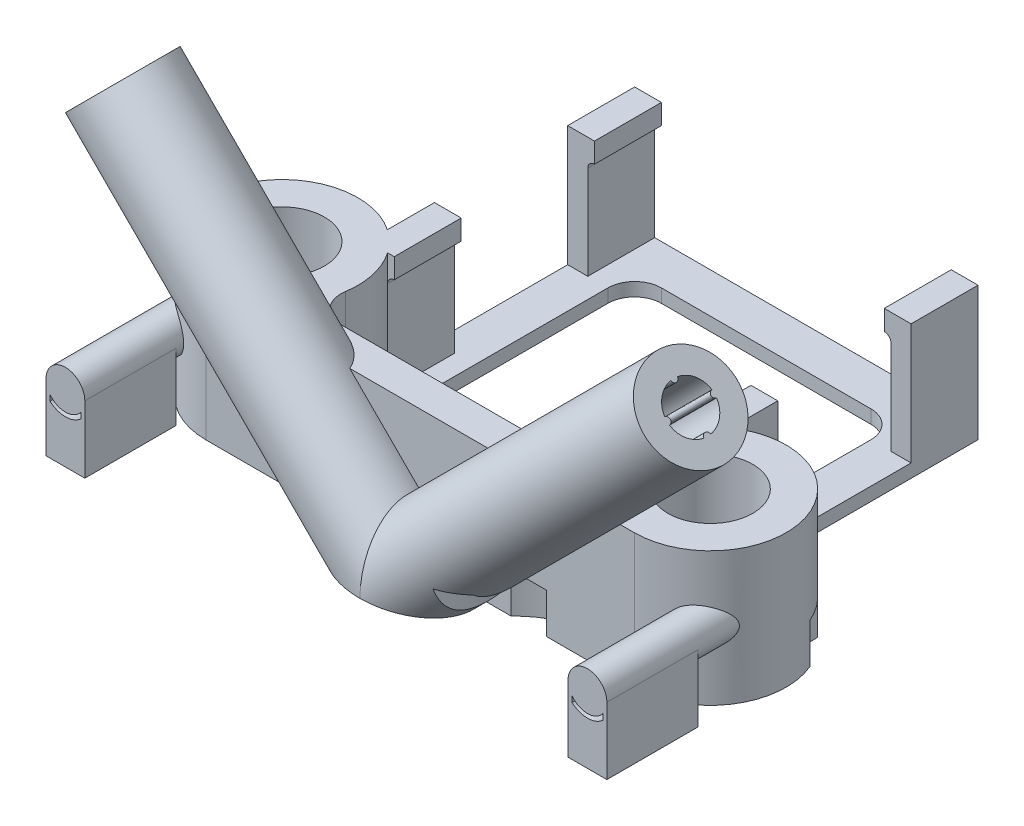
from build123d import *

# Parameters (mm, degrees)
SKETCH1_R               = 3.175
BOSS_EXTRUDE1_DEPTH     = 10
BOSS_EXTRUDE2_REACH     = 28.432
SKETCH2_R               = 1.45
BOSS_EXTRUDE3_START     = 2.5
SKETCH3_R               = 1.45
BOSS_EXTRUDE3_DEPTH     = 2.5
BOSS_EXTRUDE4_REACH     = 50.541
SKETCH6_R               = 3.5
CUT_EXTRUDE2_REACH      = 50.918
SKETCH7_R               = 1.775
CUT_EXTRUDE3_REACH      = 36.649
CUT_EXTRUDE3_END_RADIUS = 1.775
SKETCH8_R               = 1.75
BOSS_EXTRUDE5_START     = 4.5
SKETCH9_R               = 1.45
BOSS_EXTRUDE5_DEPTH     = 4.5
CUT_EXTRUDE4_REACH      = 53.252
SKETCH10_R              = 1.775
CUT_EXTRUDE5_START      = -3
CUT_EXTRUDE5_DEPTH      = 3
SKETCH12_R              = 0.25
BOSS_EXTRUDE6_DEPTH     = 20
BOSS_EXTRUDE7_REACH     = 37.818
SKETCH13_W              = 2.9
SKETCH13_H              = 6.810535762
CUT_EXTRUDE6_DEPTH      = 6.810535762
SKETCH15_W              = 25.65
SKETCH15_H              = 26.35
SKETCH15_W_2            = 19.65
SKETCH15_H_2            = 20.35
BOSS_EXTRUDE8_DEPTH     = 1
SKETCH16_W              = 1.5
SKETCH16_H              = 5
BOSS_EXTRUDE9_DEPTH     = 7.5
SKETCH17_W              = 2
SKETCH17_H              = 5
BOSS_EXTRUDE10_DEPTH    = 1.5
FILLET1_R               = 0.5
FILLET2_R               = 2


# Read off the part's stored shape, not the designer's step: Cut-Extrude5
# Some blends are built 0.0001 mm under size
with BuildPart() as part:
    # Sketch1 → Boss-Extrude1 (new body)
    with BuildSketch(Plane(origin=(0, 0, 0), x_dir=(1, 0, 0), z_dir=(0, 1, 0))):
        with BuildLine():
            Line((11.296278069, -3.175), (-11.296278069, -3.175))
            ThreePointArc((-11.296278069, -3.175), (-18.663409469, 5.011175012), (-16, -5.675))
            Line((-16, -5.675), (16, -5.675))
            ThreePointArc((16, -5.675), (18.663409469, 5.011175012), (11.296278069, -3.175))
        make_face()
        with Locations(Location((-16, 0, 0), (0, 0, 270))):
            Circle(SKETCH1_R, mode=Mode.SUBTRACT)
        with Locations(Location((16, 0, 0), (0, 0, 270))):
            Circle(SKETCH1_R, mode=Mode.SUBTRACT)
    extrude(amount=BOSS_EXTRUDE1_DEPTH)

    # Sketch2 → Boss-Extrude2 (add, up to next)
    with BuildSketch(Plane.XY.offset(5.675), mode=Mode.PRIVATE) as boss_extrude2_sk1:
        with Locations((-19.5, 5)):
            Circle(SKETCH2_R)
    boss_extrude2_tool1 = extrude(boss_extrude2_sk1.sketch, amount=-BOSS_EXTRUDE2_REACH, mode=Mode.PRIVATE) - part.part
    # Sketch2 → Boss-Extrude2 (add, up to next)
    with BuildSketch(Plane.XY.offset(5.675), mode=Mode.PRIVATE) as boss_extrude2_sk2:
        with Locations((19.5, 5)):
            Circle(SKETCH2_R)
    boss_extrude2_tool2 = extrude(boss_extrude2_sk2.sketch, amount=-BOSS_EXTRUDE2_REACH, mode=Mode.PRIVATE) - part.part
    add(boss_extrude2_tool1.solids().sort_by_distance((-19.5, 5, 5.675))[0])
    add(boss_extrude2_tool2.solids().sort_by_distance((19.5, 5, 5.675))[0])

    # Sketch3 → Boss-Extrude3 (add)
    with BuildSketch(Plane.XY.offset(5.675).offset(BOSS_EXTRUDE3_START)):
        with Locations((-19.5, 5)):
            Circle(SKETCH3_R)
        with Locations((19.5, 5)):
            Circle(SKETCH3_R)
    extrude(amount=-BOSS_EXTRUDE3_DEPTH)

    # Boss-Extrude4: up to this plane
    boss_extrude4_end = Plane(origin=(0, 0, 0), z_dir=(0, 1, 0))
    # Sketch6 → Boss-Extrude4 (add, up to the surface)
    with BuildSketch(Plane(origin=(-21.213203436, 21.213203436, 0), x_dir=(0.7071067811865477, 0.7071067811865475, 0), z_dir=(-0.7071067811865475, 0.7071067811865477, 0)), mode=Mode.PRIVATE) as boss_extrude4_sk1:
        with Locations(Location((0, -6.675, 0), (0, 0, 180))):
            Circle(SKETCH6_R)
    boss_extrude4_tool1 = split(extrude(boss_extrude4_sk1.sketch, amount=-BOSS_EXTRUDE4_REACH, mode=Mode.PRIVATE), bisect_by=boss_extrude4_end, keep=Keep.BOTH, mode=Mode.PRIVATE)
    boss_extrude4 = boss_extrude4_tool1.solids().sort_by_distance((-21.213203, 21.213203, 6.675))[0]
    add(boss_extrude4)

    # Cut-Extrude2: up to this plane
    cut_extrude2_end = Plane(origin=(0, 0, 0), z_dir=(0, 1, 0))
    # Sketch7 → Cut-Extrude2 (cut, up to the surface)
    with BuildSketch(Plane(origin=(-21.213203436, 21.213203436, 0), x_dir=(0, 0, 1), z_dir=(-0.7071067811865476, 0.7071067811865476, 0)), mode=Mode.PRIVATE) as cut_extrude2_sk1:
        with Locations(Location((6.675, 0, 0), (0, 0, 270))):
            Circle(SKETCH7_R)
    cut_extrude2_tool1 = split(extrude(cut_extrude2_sk1.sketch, amount=-CUT_EXTRUDE2_REACH, mode=Mode.PRIVATE), bisect_by=cut_extrude2_end, keep=Keep.BOTH, mode=Mode.PRIVATE)
    cut_extrude2 = cut_extrude2_tool1.solids().sort_by_distance((-21.213203, 21.213203, 6.675))[0]
    add(cut_extrude2, mode=Mode.SUBTRACT)

    # Cut-Extrude3: up to this cylinder (the profile starts outside it)
    cut_extrude3_end = Plane(origin=(-5, 5, 6.675), z_dir=(-0.7071067811865476, 0.7071067811865476, 0)) * Cylinder(CUT_EXTRUDE3_END_RADIUS, 77.848, mode=Mode.PRIVATE)
    # Sketch8 → Cut-Extrude3 (cut, up to the surface)
    with BuildSketch(Plane(origin=(0, 0, 3.175), x_dir=(-1, 0, 0), z_dir=(0, 0, -1)), mode=Mode.PRIVATE) as cut_extrude3_sk1:
        with Locations((5, 5)):
            Circle(SKETCH8_R)
    cut_extrude3_tool1 = extrude(cut_extrude3_sk1.sketch, amount=-CUT_EXTRUDE3_REACH, mode=Mode.PRIVATE) - cut_extrude3_end
    cut_extrude3 = cut_extrude3_tool1.solids().sort_by_distance((-5, 5, 3.175))[0]
    add(cut_extrude3, mode=Mode.SUBTRACT)

    # Mirror1: Boss-Extrude4, Cut-Extrude2, Cut-Extrude3 across plane
    add(boss_extrude4.mirror(Plane(origin=(0, 0, 0), x_dir=(0, 0, 1), z_dir=(1, 0, 0))))
    add(cut_extrude2.mirror(Plane(origin=(0, 0, 0), x_dir=(0, 0, 1), z_dir=(1, 0, 0))), mode=Mode.SUBTRACT)
    add(cut_extrude3.mirror(Plane(origin=(0, 0, 0), x_dir=(0, 0, 1), z_dir=(1, 0, 0))), mode=Mode.SUBTRACT)

    # Sketch9 → Boss-Extrude5 (add)
    with BuildSketch(Plane.XY.offset(8.175).offset(BOSS_EXTRUDE5_START)):
        with Locations((-19.5, 5)):
            Circle(SKETCH9_R)
        with Locations((19.5, 5)):
            Circle(SKETCH9_R)
    extrude(amount=-BOSS_EXTRUDE5_DEPTH)

    # Cut-Extrude4: up to this face of the body (flat: up to its plane)
    cut_extrude4_end = Plane(part.part.faces().sort_by_distance((10.371708245, 0, 5.213432562))[0])
    # Sketch10 → Cut-Extrude4 (cut, up to the picked face)
    with BuildSketch(Plane(origin=(-21.213203436, 21.213203436, 0), x_dir=(0, 0, 1), z_dir=(-0.7071067811865476, 0.7071067811865476, 0)), mode=Mode.PRIVATE) as cut_extrude4_sk1:
        with Locations(Location((6.675, 0, 0), (0, 0, 270))):
            Circle(SKETCH10_R)
    cut_extrude4_tool1 = split(extrude(cut_extrude4_sk1.sketch, amount=-CUT_EXTRUDE4_REACH, mode=Mode.PRIVATE), bisect_by=cut_extrude4_end, keep=Keep.BOTH, mode=Mode.PRIVATE)
    add(cut_extrude4_tool1.solids().sort_by(Axis((-21.213203, 21.213203, 6.675), (0.7071067811865476, -0.7071067811865476, 0)))[0], mode=Mode.SUBTRACT)

    # Cut-Extrude5 outline → Cut-Extrude5 (cut)
    with BuildSketch(Plane.XZ.offset(CUT_EXTRUDE5_START)):
        with BuildLine():
            Line((10.519576691, 3.625), (16, 3.625))
            ThreePointArc((16, 3.625), (18.563262082, 2.563262082), (19.625, 0))
            Line((19.625, 0), (19.625, -4.366348589))
            ThreePointArc((19.625, -4.366348589), (20.553899173, -3.386388537), (21.225, -2.214723459))
            Line((21.225, -2.214723459), (21.225, 0))
            ThreePointArc((21.225, 0), (19.694632932, 3.694632932), (16, 5.225))
            Line((16, 5.225), (10.519576691, 5.225))
            add(Edge.make_bspline(
                [(10.519576691, 5.225), (6.782537152, 6.461403164), (6.878008537, 10.175)],
                knots=[0.842781907, 0.842781907, 0.842781907, 1.842781907, 1.842781907, 1.842781907], degree=2))
            Line((6.878008537, 10.175), (5.102744062, 10.175))
            add(Edge.make_bspline(
                [(5.102744062, 10.175), (5.38264147, 4.912584992), (10.519576691, 3.625)],
                knots=[0, 0, 0, 1, 1, 1], degree=2))
        make_face()
    extrude(amount=CUT_EXTRUDE5_DEPTH, mode=Mode.SUBTRACT)

    # Sketch12 → Boss-Extrude6 (add)
    with BuildSketch(Plane(origin=(-21.213203436, 21.213203436, 0), x_dir=(0, 0, 1), z_dir=(-0.7071067811865476, 0.7071067811865476, 0))):
        with Locations((6.675, 1.775)):
            Circle(SKETCH12_R)
        with Locations((4.9, 0)):
            Circle(SKETCH12_R)
        with Locations((6.675, -1.775)):
            Circle(SKETCH12_R)
        with Locations((8.45, 0)):
            Circle(SKETCH12_R)
    boss_extrude6 = extrude(amount=-BOSS_EXTRUDE6_DEPTH)

    # Mirror2: Boss-Extrude6 across plane
    add(boss_extrude6.mirror(Plane(origin=(0, 0, 0), x_dir=(0, 0, 1), z_dir=(1, 0, 0))))

    # Sketch13 → Boss-Extrude7 (add, up to next)
    with BuildSketch(Plane.XZ, mode=Mode.PRIVATE) as boss_extrude7_sk1:
        with Locations((-19.5, 9.269732119)):
            Rectangle(SKETCH13_W, SKETCH13_H)
    boss_extrude7_tool1 = extrude(boss_extrude7_sk1.sketch, amount=-BOSS_EXTRUDE7_REACH, mode=Mode.PRIVATE) - part.part
    # Sketch13 → Boss-Extrude7 (add, up to next)
    with BuildSketch(Plane.XZ, mode=Mode.PRIVATE) as boss_extrude7_sk2:
        with Locations((19.5, 9.269732119)):
            Rectangle(SKETCH13_W, SKETCH13_H)
    boss_extrude7_tool2 = extrude(boss_extrude7_sk2.sketch, amount=-BOSS_EXTRUDE7_REACH, mode=Mode.PRIVATE) - part.part
    add(boss_extrude7_tool1.solids().sort_by_distance((-19.5, 0, 9.269732))[0])
    add(boss_extrude7_tool2.solids().sort_by_distance((19.5, 0, 9.269732))[0])

    # Sketch14 → Cut-Extrude6 (cut)
    with BuildSketch(Plane.XY.offset(12.675)):
        with BuildLine():
            Line((-20.65, 4.116823913), (-20.65, 3.680909404))
            ThreePointArc((-20.65, 3.680909404), (-19.5, 3.25), (-18.35, 3.680909404))
            Line((-18.35, 3.680909404), (-18.35, 4.116823913))
            ThreePointArc((-18.35, 4.116823913), (-19.5, 3.55), (-20.65, 4.116823913))
        make_face()
        with BuildLine():
            ThreePointArc((18.35, 3.680909404), (19.5, 3.25), (20.65, 3.680909404))
            Line((20.65, 3.680909404), (20.65, 4.116823913))
            ThreePointArc((20.65, 4.116823913), (19.5, 3.55), (18.35, 4.116823913))
            Line((18.35, 4.116823913), (18.35, 3.680909404))
        make_face()
    extrude(amount=-CUT_EXTRUDE6_DEPTH, mode=Mode.SUBTRACT)

    # Sketch15 → Boss-Extrude8 (add)
    with BuildSketch(Plane(origin=(0, 0, 0), x_dir=(1, 0, 0), z_dir=(0, 1, 0))):
        with Locations((0, 10)):
            Rectangle(SKETCH15_W, SKETCH15_H)
        with Locations((0, 10)):
            Rectangle(SKETCH15_W_2, SKETCH15_H_2, mode=Mode.SUBTRACT)
    extrude(amount=BOSS_EXTRUDE8_DEPTH)

    # Sketch16 → Boss-Extrude9 (add)
    with BuildSketch(Plane(origin=(0, 1, 0), x_dir=(1, 0, 0), z_dir=(0, 1, 0))):
        with Locations((-12.075, 20.675)):
            Rectangle(SKETCH16_W, SKETCH16_H)
        with BuildLine():
            Line((-11.325, 8.217141588), (-12.825, 8.217141588))
            Line((-12.825, 8.217141588), (-12.825, 4.703721931))
            ThreePointArc((-12.825, 4.703721931), (-12.005240273, 4.030821222), (-11.325, 3.217141588))
            Line((-11.325, 3.217141588), (-11.325, 8.217141588))
        make_face()
        with Locations((12.075, 20.675)):
            Rectangle(SKETCH16_W, SKETCH16_H)
        with BuildLine():
            Line((12.825, 8.217141588), (11.325, 8.217141588))
            Line((11.325, 8.217141588), (11.325, 3.217141588))
            ThreePointArc((11.325, 3.217141588), (12.005240273, 4.030821222), (12.825, 4.703721931))
            Line((12.825, 4.703721931), (12.825, 8.217141588))
        make_face()
    extrude(amount=BOSS_EXTRUDE9_DEPTH)

    # Sketch17 → Boss-Extrude10 (add)
    with BuildSketch(Plane(origin=(0, 8.5, 0), x_dir=(1, 0, 0), z_dir=(0, 1, 0))):
        with Locations((-11.825, 20.675)):
            Rectangle(SKETCH17_W, SKETCH17_H)
        with Locations((-11.825, 5.717141588)):
            Rectangle(SKETCH17_W, SKETCH17_H)
        with Locations((11.825, 20.675)):
            Rectangle(SKETCH17_W, SKETCH17_H)
        with Locations((11.825, 5.717141588)):
            Rectangle(SKETCH17_W, SKETCH17_H)
    extrude(amount=BOSS_EXTRUDE10_DEPTH)

    # Fillet1
    fillet1_edges = [part.edges().sort_by_distance(p)[0] for p in [
        (11.325, 8.5, -5.717141588),
        (11.325, 8.5, -20.675),
        (-11.325, 8.5, -5.717141588),
        (-11.325, 8.5, -20.675),
    ]]
    fillet(fillet1_edges, radius=FILLET1_R - 0.0001)  # a hair under: the kernel refuses the full size

    # Fillet2
    # the kernel refuses this fillet: 2 mm, written as the material it adds along each edge
    with BuildSketch(Plane(origin=(-11.296278069, 1, 3.175), x_dir=(1, 0, 0), z_dir=(0, 1, 0))) as fillet2_piece_1:
        with BuildLine():
            CenterArc((2.880801786, 2), FILLET2_R, 171.193701983, 98.806298017)
            ThreePointArc((0.904378667, 2.306188925), (0.579558093, 1.103146435), (0, 0))
            Line((0, 0), (2.880801786, 0))
        make_face()
    extrude(amount=9)
    with BuildSketch(Plane(origin=(11.296278069, 1, 3.175), x_dir=(-1, 0, 0), z_dir=(0, 1, 0))) as fillet2_piece_2:
        with BuildLine():
            CenterArc((2.880801786, -2), FILLET2_R, 90, 98.806298017)
            ThreePointArc((0.904378667, -2.306188925), (0.579558093, -1.103146435), (0, 0))
            Line((0, 0), (2.880801786, 0))
        make_face()
    extrude(amount=9)
    with BuildSketch(Plane(origin=(-9.825, 0, -20.175), x_dir=(1, 0, 0), z_dir=(0, 1, 0)), Plane(origin=(-9.825, 0, 0.175), x_dir=(0, 0, -1), z_dir=(0, 1, 0)), Plane(origin=(9.825, 0, -20.175), x_dir=(0, 0, 1), z_dir=(0, 1, 0))) as fillet2_piece_3:
        with BuildLine():
            CenterArc((FILLET2_R, -FILLET2_R), FILLET2_R, 90, 90)
            Line((0, -FILLET2_R), (0, 0))
            Line((0, 0), (FILLET2_R, 0))
        make_face()
    extrude(amount=1)
    with BuildSketch(Plane(origin=(9.825, 0, 0.175), x_dir=(0, 0, -1), z_dir=(0, 1, 0))) as fillet2_piece_4:
        with BuildLine():
            CenterArc((FILLET2_R, FILLET2_R), FILLET2_R, 180, 90)
            Line((0, FILLET2_R), (0, 0))
            Line((0, 0), (FILLET2_R, 0))
        make_face()
    extrude(amount=1)


solid = part.part
